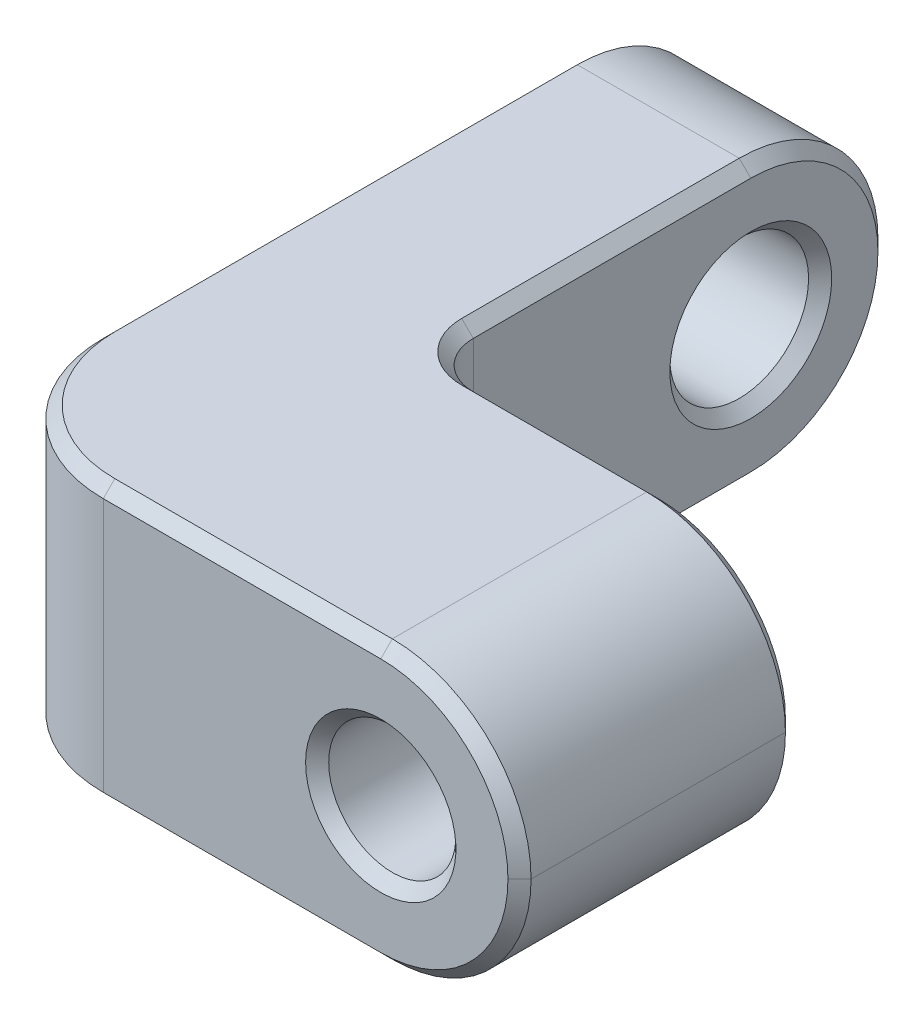
from build123d import *

# Parameters (mm, degrees)
BOSS_EXTRUDE1_DEPTH     = 4.7625
CUT_EXTRUDE1_DEPTH      = 26.250733281
CUT_EXTRUDE1_DEPTH_BACK = 26.250733281
SKETCH2_R               = 2.1828125
CUT_EXTRUDE2_DEPTH      = 29.794641971
CUT_EXTRUDE2_DEPTH_BACK = 29.794641971
SKETCH3_R               = 2.38125
FILLET1_R               = 4.7625
FILLET2_R               = 1.5875
CHAMFER1_SIZE           = 0.396875


with BuildPart() as part:
    # Sketch1 → Boss-Extrude1 (new, symmetric)
    with BuildSketch(Plane(origin=(0, 0, 0), x_dir=(1, 0, 0), z_dir=(0, 1, 0))):
        Polygon((0, 0), (19.05, 0), (19.05, 9.525), (6.35, 9.525), (6.35, 25.4), (0, 25.4), align=None)
    extrude(amount=BOSS_EXTRUDE1_DEPTH, both=True)

    # Sketch2 → Cut-Extrude1 (cut, two sides: drawn at the far end of the back side and taken through both)
    with BuildSketch(Plane(origin=(0, 0, -9.525), x_dir=(-1, 0, 0), z_dir=(0, 0, -1)).offset(-CUT_EXTRUDE1_DEPTH_BACK)):
        with Locations((-14.2875, 0)):
            Circle(SKETCH2_R)
    extrude(amount=CUT_EXTRUDE1_DEPTH + CUT_EXTRUDE1_DEPTH_BACK, mode=Mode.SUBTRACT)

    # Sketch3 → Cut-Extrude2 (cut, two sides: drawn at the far end of the back side and taken through both)
    with BuildSketch(Plane(origin=(6.35, 0, 0), x_dir=(0, 0, -1), z_dir=(1, 0, 0)).offset(-CUT_EXTRUDE2_DEPTH_BACK)):
        with Locations((20.6375, 0)):
            Circle(SKETCH3_R)
    extrude(amount=CUT_EXTRUDE2_DEPTH + CUT_EXTRUDE2_DEPTH_BACK, mode=Mode.SUBTRACT)

    # Fillet1
    fillet1_edges = [part.edges().sort_by_distance(p)[0] for p in [
        (0, 0, 0),
        (3.175, -4.7625, -25.4),
        (3.175, 4.7625, -25.4),
        (19.05, -4.7625, -4.7625),
        (19.05, 4.7625, -4.7625),
    ]]
    fillet(fillet1_edges, radius=FILLET1_R - 0.0001)  # a hair under: the kernel refuses the full size

    # Fillet2
    fillet2_edges = [part.edges().sort_by_distance(p)[0] for p in [
        (6.35, 0, -9.525),
    ]]
    fillet(fillet2_edges, radius=FILLET2_R)

    # Chamfer1
    chamfer1_edges = [part.edges().sort_by_distance(p)[0] for p in [
        (16.4703125, 0, 0),
        (16.4703125, 0, -9.525),
        (0, 0, -18.25625),
        (6.35, 0, -18.25625),
        (9.525, -4.7625, 0),
        (9.525, 4.7625, 0),
        (17.655125335, 3.367625335, 0),
        (17.655125335, -3.367625335, 0),
        (0, -4.7625, -12.7),
        (11.11255, -4.7625, -9.525),
        (1.394874665, -4.7625, -1.394874665),
        (0, 4.7625, -12.7),
        (0, 3.367625335, -24.005125335),
        (0, -3.367625335, -24.005125335),
        (11.11255, 4.7625, -9.525),
        (1.394874665, 4.7625, -1.394874665),
        (6.35, 3.367625335, -24.005125335),
        (6.35, -3.367625335, -24.005125335),
        (17.655125335, 3.367625335, -9.525),
        (17.655125335, -3.367625335, -9.525),
        (6.35, -4.7625, -15.87505),
        (6.35, 4.7625, -15.87505),
        (6.814967985, -4.7625, -9.989967985),
        (6.814967985, 4.7625, -9.989967985),
    ]]
    chamfer(chamfer1_edges, length=CHAMFER1_SIZE)


solid = part.part
